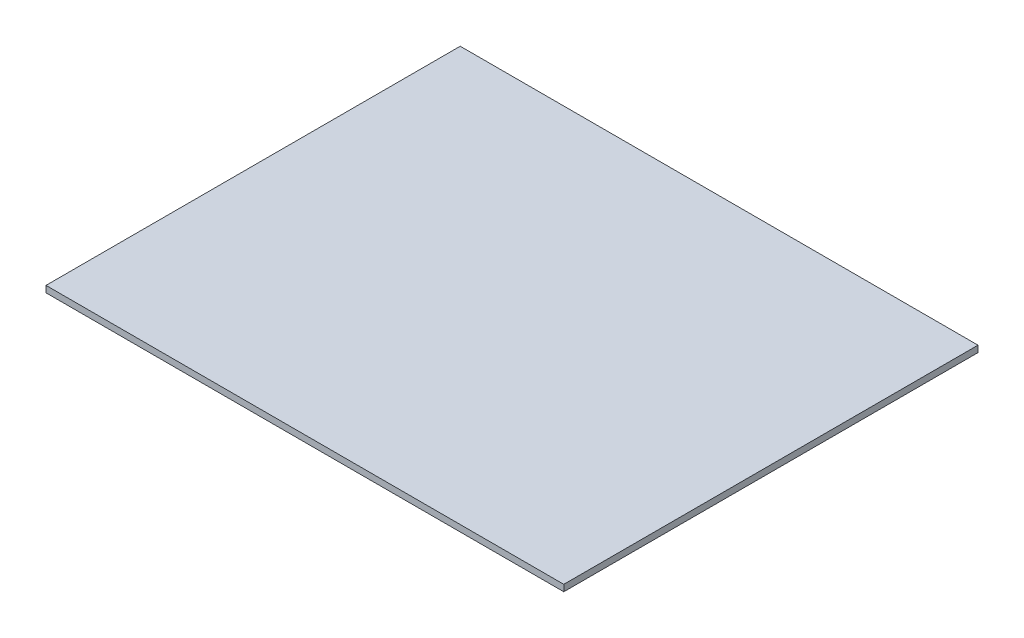
from build123d import *

# Parameters (mm, degrees)
SKETCH1_W           = 381
SKETCH1_H           = 304.8
BOSS_EXTRUDE1_DEPTH = 4.7625


with BuildPart() as part:
    # Sketch1 → Boss-Extrude1 (new body)
    with BuildSketch(Plane(origin=(0, 0, 0), x_dir=(1, 0, 0), z_dir=(0, 1, 0))):
        Rectangle(SKETCH1_W, SKETCH1_H)
    extrude(amount=BOSS_EXTRUDE1_DEPTH)


solid = part.part
